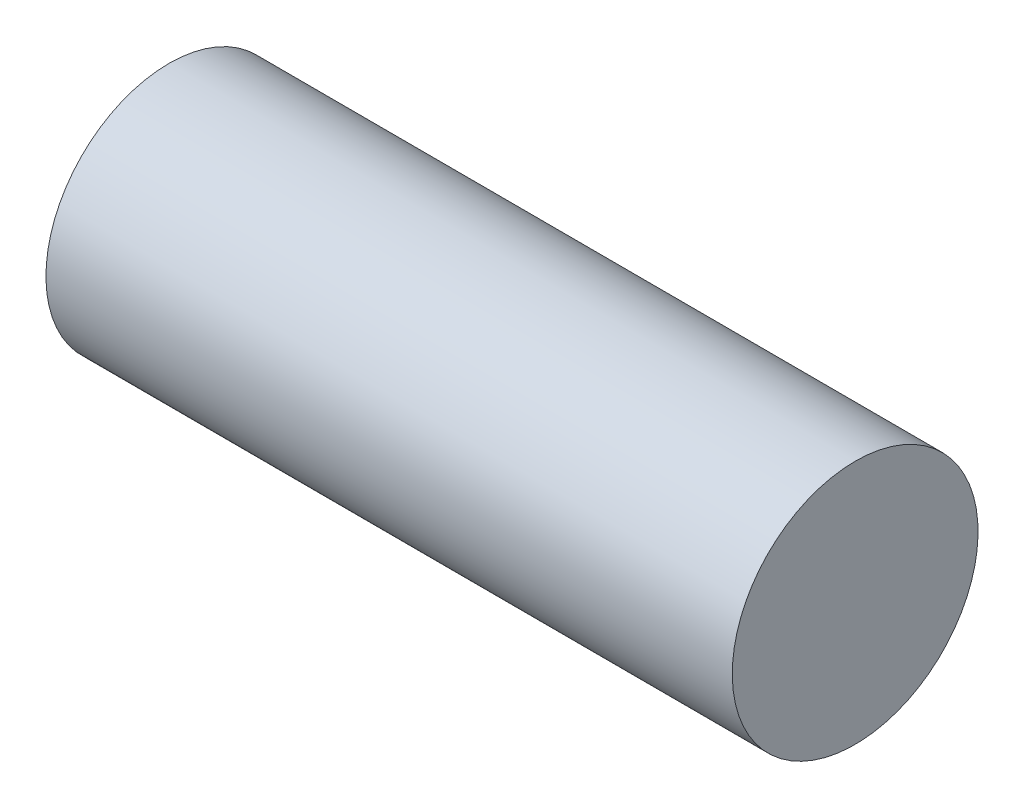
from build123d import *

# Parameters (mm, degrees)
SWEEP1_PROFILE_R = 4.699


with BuildPart() as part:
    # Sweep1: sweep along a curve in space
    with BuildLine() as sweep1_path:
        Line((-13.558042445, 200.895063597, 163.321797228), (12.685805764, 200.845332567, 163.321797176))
    # Sweep1 profile (on start of the path) → Sweep1 (sweep)
    with BuildSketch(Plane(origin=(-13.558042445, 200.895063597, 163.321797228), x_dir=(0.0018949561087545296, 0.9999982045690612, 0), z_dir=(0.9999982045690612, -0.0018949561087545296, -1.9777826375161676e-09))):
        Circle(SWEEP1_PROFILE_R)
    sweep(path=sweep1_path.line)


solid = part.part
